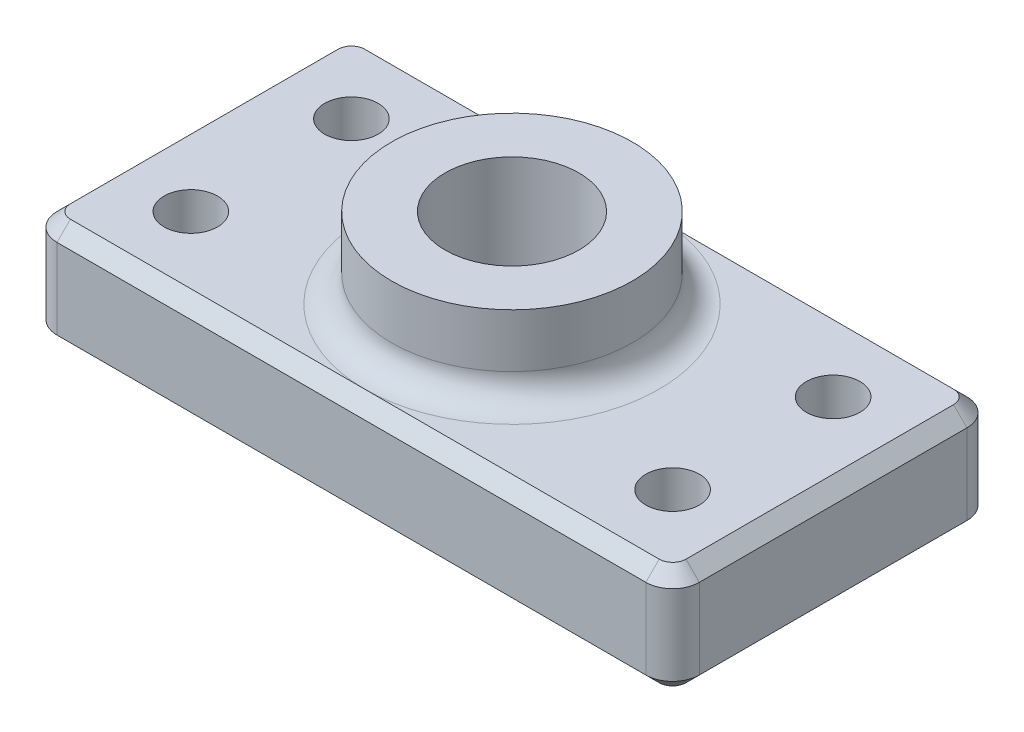
from build123d import *

# Parameters (mm, degrees)
SKETCH1_W           = 6
SKETCH1_H           = 3
BOSS_EXTRUDE1_DEPTH = 1
SKETCH3_R           = 1.125
BOSS_EXTRUDE3_DEPTH = 0.75
SKETCH5_R           = 0.625
CUT_EXTRUDE3_DEPTH  = 4.783186488
FILLET1_R           = 0.25
SKETCH6_R           = 0.25
CUT_EXTRUDE4_DEPTH  = 4.5
FILLET3_R           = 0.25
CHAMFER2_SIZE       = 0.125


with BuildPart() as part:
    # Sketch1 → Boss-Extrude1 (new body)
    with BuildSketch(Plane(origin=(0, 0, 0), x_dir=(1, 0, 0), z_dir=(0, 1, 0))):
        Rectangle(SKETCH1_W, SKETCH1_H)
    extrude(amount=BOSS_EXTRUDE1_DEPTH)

    # Sketch3 → Boss-Extrude3 (add)
    with BuildSketch(Plane(origin=(0, 1, 0), x_dir=(1, 0, 0), z_dir=(0, 1, 0))):
        with Locations(Location((0, 0, 0), (0, 0, 270))):
            Circle(SKETCH3_R)
    extrude(amount=BOSS_EXTRUDE3_DEPTH)

    # Sketch5 → Cut-Extrude3 (cut, through all)
    with BuildSketch(Plane(origin=(0, 0, 0), x_dir=(1, 0, 0), z_dir=(0, 1, 0))):
        with Locations(Location((0, 0, 0), (0, 0, 270))):
            Circle(SKETCH5_R)
    extrude(amount=CUT_EXTRUDE3_DEPTH, mode=Mode.SUBTRACT)

    # Fillet1
    fillet1_edges = [part.edges().sort_by_distance(p)[0] for p in [
        (0, 1, -1.125),
    ]]
    fillet(fillet1_edges, radius=FILLET1_R)

    # Sketch6 → Cut-Extrude4 (cut, through all)
    with BuildSketch(Plane(origin=(0, 1, 0), x_dir=(1, 0, 0), z_dir=(0, 1, 0))):
        with Locations(Location((2.25, -0.75, 0), (0, 0, 270))):
            Circle(SKETCH6_R)
        with Locations(Location((2.25, 0.75, 0), (0, 0, 270))):
            Circle(SKETCH6_R)
        with Locations(Location((-2.25, 0.75, 0), (0, 0, 270))):
            Circle(SKETCH6_R)
        with Locations(Location((-2.25, -0.75, 0), (0, 0, 270))):
            Circle(SKETCH6_R)
    extrude(amount=-CUT_EXTRUDE4_DEPTH, mode=Mode.SUBTRACT)

    # Fillet3
    fillet3_edges = [part.edges().sort_by_distance(p)[0] for p in [
        (3, 0.5, 1.5),
        (-3, 0.5, 1.5),
        (-3, 0.5, -1.5),
        (3, 0.5, -1.5),
    ]]
    fillet(fillet3_edges, radius=FILLET3_R)

    # Chamfer2
    chamfer2_edges = [part.edges().sort_by_distance(p)[0] for p in [
        (0, 0, -1.5),
        (0, 1, -1.5),
        (3, 0, 0),
        (0, 0, 1.5),
        (-3, 0, 0),
        (-2.926776695, 0, -1.426776695),
        (-2.926776695, 0, 1.426776695),
        (2.926776695, 0, 1.426776695),
        (2.926776695, 0, -1.426776695),
        (3, 1, 0),
        (-3, 1, 0),
        (0, 1, 1.5),
        (-2.926776695, 1, -1.426776695),
        (-2.926776695, 1, 1.426776695),
        (2.926776695, 1, 1.426776695),
        (2.926776695, 1, -1.426776695),
    ]]
    chamfer(chamfer2_edges, length=CHAMFER2_SIZE - 0.0001)  # a hair under: the kernel refuses the full size


solid = part.part
